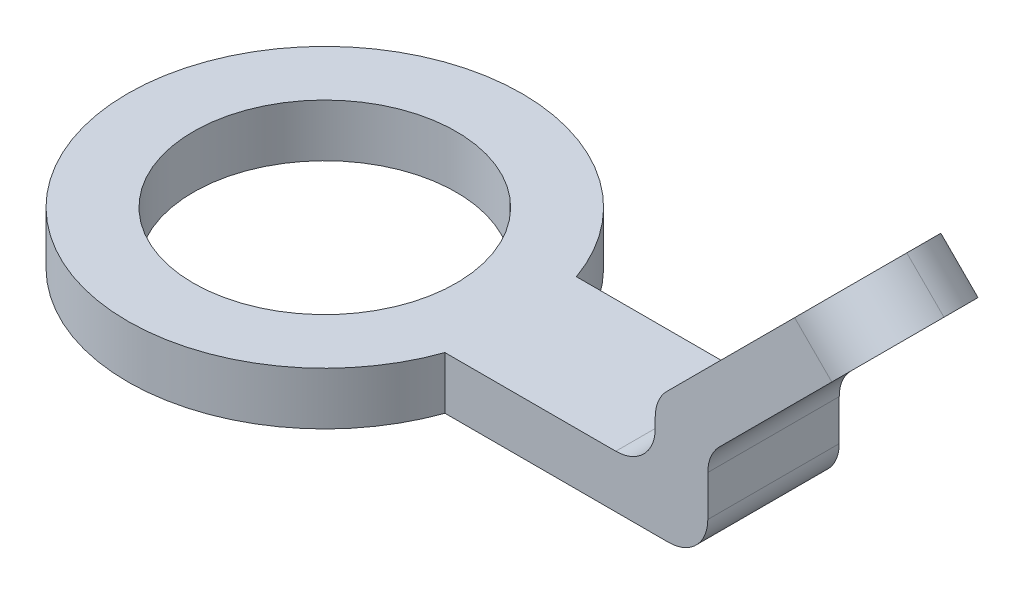
from build123d import *

# Parameters (mm, degrees)
SKETCH2_R            = 10
BOSS_EXTRUDE1_DEPTH  = 4
BOSS_EXTRUDE2_DEPTH  = 10
FILLET1_R            = 5
M3_CLEARANCE_HOLE1_D = 3.6
FILLET2_R            = 3


with BuildPart() as part:
    # Sketch2 → Boss-Extrude1 (new body)
    with BuildSketch(Plane(origin=(0, 0, 0), x_dir=(1, 0, 0), z_dir=(0, 1, 0))):
        with BuildLine():
            Line((34.142135624, 5), (34.142135624, -5))
            Line((34.142135624, -5), (14.142135624, -5))
            ThreePointArc((14.142135624, -5), (-15, 0), (14.142135624, 5))
            Line((14.142135624, 5), (34.142135624, 5))
        make_face()
        with Locations(Location((0, 0, 0), (0, 0, 270))):
            Circle(SKETCH2_R, mode=Mode.SUBTRACT)
    extrude(amount=BOSS_EXTRUDE1_DEPTH)

    # Sketch3 → Boss-Extrude2 (add)
    with BuildSketch(Plane.XY.offset(5)):
        Polygon((34.142135624, 4), (34.142135624, 7.343145751), (47.112698372, 20.313708499), (44.284271247, 23.142135624), (30.142135624, 9), (30.142135624, 4), align=None)
    extrude(amount=-BOSS_EXTRUDE2_DEPTH)

    # Fillet1
    fillet1_edges = [part.edges().sort_by_distance(p)[0] for p in [
        (45.69848481, 21.727922061, 5),
        (45.69848481, 21.727922061, -5),
    ]]
    fillet(fillet1_edges, radius=FILLET1_R - 0.0001)  # a hair under: the kernel refuses the full size

    # M3 Clearance Hole1 (through all)
    with Locations(Plane(origin=(10.571067812, -10.571067812, 0), x_dir=(0.7071067811865486, 0.7071067811865466, 0), z_dir=(-0.7071067811865466, 0.7071067811865486, 0))):
        with Locations((42.67766953, 0)):
            Hole(M3_CLEARANCE_HOLE1_D / 2)

    # Fillet2
    fillet2_edges = [part.edges().sort_by_distance(p)[0] for p in [
        (30.142135624, 4, 0),
        (30.142135624, 9, 0),
        (34.142135624, 7.343145751, 0),
        (34.142135624, 0, 0),
    ]]
    fillet(fillet2_edges, radius=FILLET2_R)


solid = part.part
